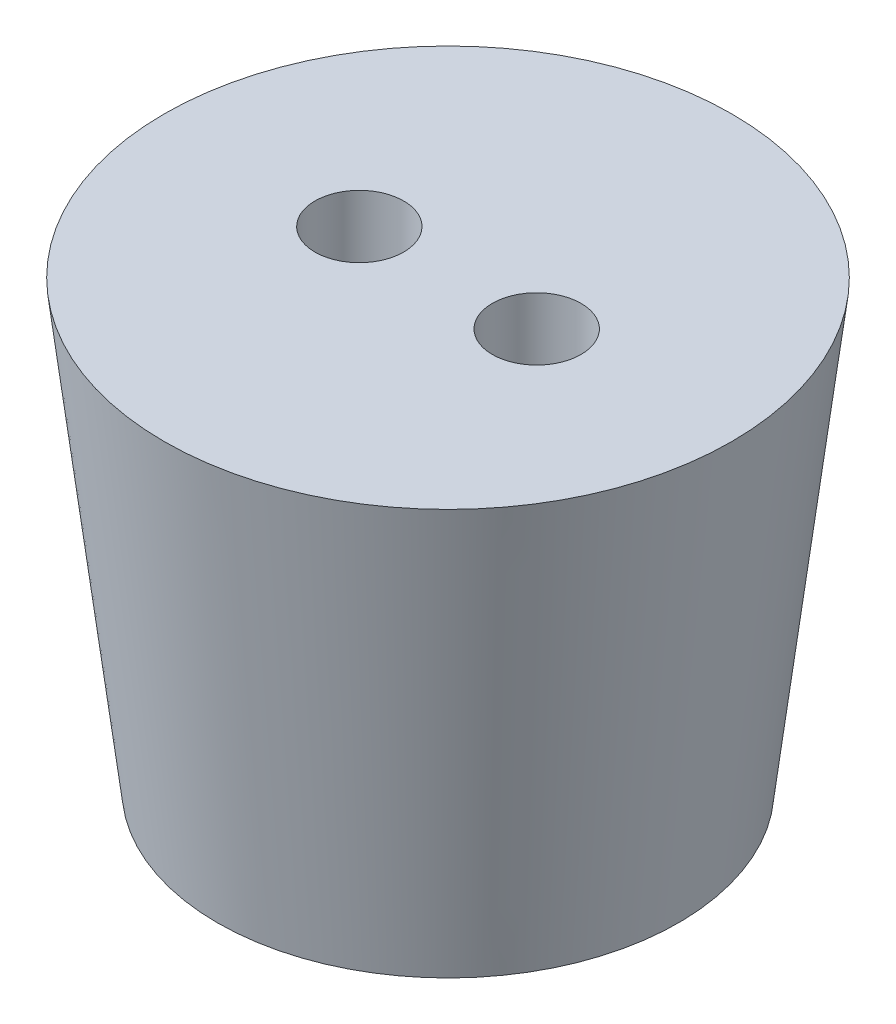
from build123d import *

# Parameters (mm, degrees)
SKETCH13_R         = 2.5
CUT_EXTRUDE1_DEPTH = 34.7194306


# Read off the part's stored shape, not the designer's step: Boundary2
with BuildPart() as part:
    # Boundary2 outline → Boundary2 (revolve)
    with BuildSketch(Plane.XY):
        Polygon((0, 0), (13, 0), (16, 25), (0, 25), align=None)
    revolve(axis=Axis((0, 0, 0), (0, 1, 0)))

    # Sketch13 → Cut-Extrude1 (cut, through all)
    with BuildSketch(Plane.XZ):
        with Locations(Location((5, 0, 0), (0, 0, 270))):
            Circle(SKETCH13_R)
        with Locations(Location((-5, 0, 0), (0, 0, 90))):
            Circle(SKETCH13_R)
    extrude(amount=-CUT_EXTRUDE1_DEPTH, mode=Mode.SUBTRACT)


solid = part.part
